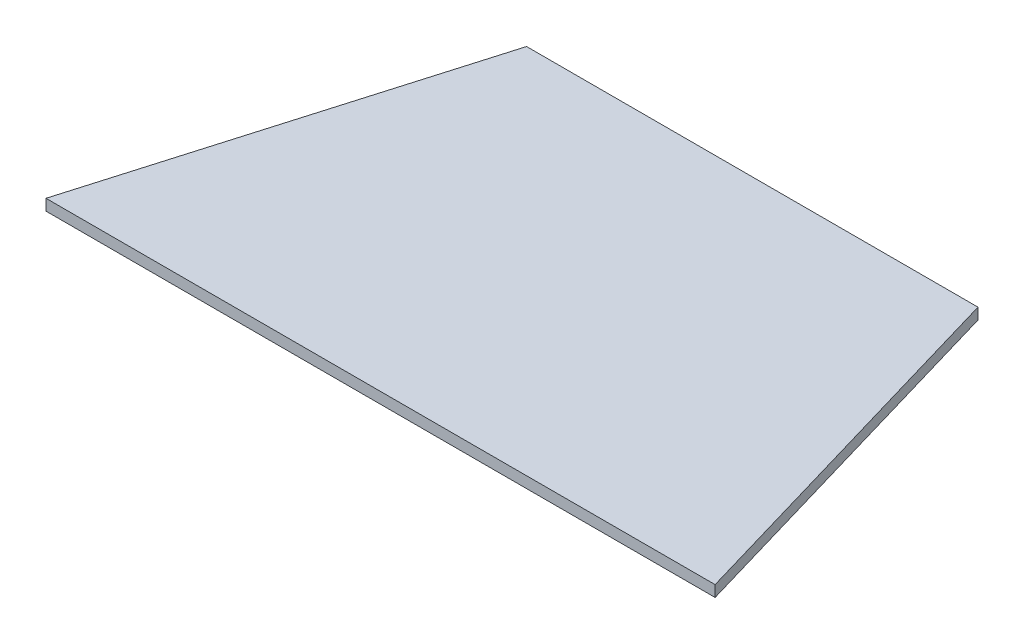
from build123d import *

# Parameters (mm, degrees)
BOSS_EXTRUDE1_DEPTH = 3


with BuildPart() as part:
    # Sketch1 → Boss-Extrude1 (new body)
    with BuildSketch(Plane(origin=(0, 0, 0), x_dir=(1, 0, 0), z_dir=(0, 1, 0))):
        Polygon((0, 0), (180, 0), (150.720058283, 100), (29.279941717, 100), align=None)
    extrude(amount=BOSS_EXTRUDE1_DEPTH)


solid = part.part
